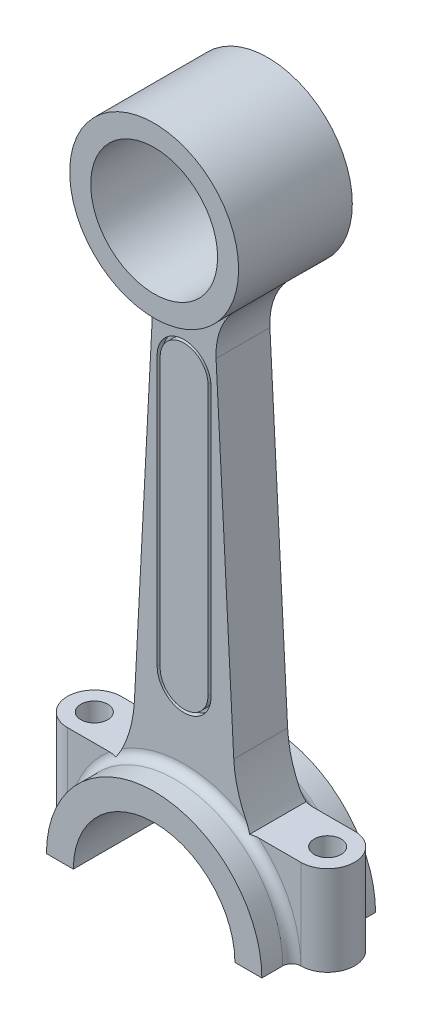
from build123d import *

# Parameters (mm, degrees)
SKETCH1_R               = 28.232840849
SKETCH1_R_2             = 21.20600046
BOSS_EXTRUDE1_DEPTH     = 19
BOSS_EXTRUDE1_2_DEPTH   = 19
BOSS_EXTRUDE2_DEPTH     = 9
FILLET1_R               = 22.5
FILLET2_R               = 40
CUT_EXTRUDE_THIN1_DEPTH = 2
BOSS_EXTRUDE3_DEPTH     = 30
SKETCH5_R               = 4.5
CUT_EXTRUDE1_DEPTH      = 30
CUT_EXTRUDE2_DEPTH      = 30
FILLET3_R               = 3


with BuildPart() as part:
    # Sketch1 → Boss-Extrude1 (new, symmetric)
    with BuildSketch(Plane.XY):
        with Locations((0, 201.2)):
            Circle(SKETCH1_R)
        with Locations((0, 201.2)):
            Circle(SKETCH1_R_2, mode=Mode.SUBTRACT)
    extrude(amount=BOSS_EXTRUDE1_DEPTH, both=True)



with BuildPart() as body_2:
    # Sketch1 → Boss-Extrude1 2 (new, symmetric)
    with BuildSketch(Plane.XY):
        with BuildLine():
            Line((-36, 0), (-27, 0))
            ThreePointArc((-27, 0), (0, 27), (27, 0))
            Line((27, 0), (36, 0))
            ThreePointArc((36, 0), (0, 36), (-36, 0))
        make_face()
    extrude(amount=BOSS_EXTRUDE1_2_DEPTH, both=True)


with BuildPart() as part_1:
    add(part.part)

    add(body_2.part)  # Boss-Extrude2 merges body 2
    # Sketch2 → Boss-Extrude2 (add, symmetric)
    with BuildSketch(Plane.XY):
        with BuildLine():
            Line((-10, 174.797475454), (-17.512343456, 31.453423132))
            ThreePointArc((-17.512343456, 31.453423132), (0, 36), (17.512343456, 31.453423132))
            Line((17.512343456, 31.453423132), (10, 174.797475454))
            ThreePointArc((10, 174.797475454), (0, 172.967159151), (-10, 174.797475454))
        make_face()
    extrude(amount=BOSS_EXTRUDE2_DEPTH, both=True)

    # Fillet1
    fillet1_edges = [part_1.edges().sort_by_distance(p)[0] for p in [
        (10, 174.797475454, 0),
        (-10, 174.797475454, 0),
    ]]
    fillet(fillet1_edges, radius=FILLET1_R)

    # Fillet2
    fillet2_edges = [part_1.edges().sort_by_distance(p)[0] for p in [
        (-17.512343456, 31.453423132, 0),
        (17.512343456, 31.453423132, 0),
    ]]
    fillet(fillet2_edges, radius=FILLET2_R)

    # Sketch3 → Cut-Extrude-Thin1 (cut, symmetric)
    with BuildSketch(Plane.XY.offset(9)):
        with BuildLine():
            Line((-9, 62.771407141), (-9, 152.771407141))
            ThreePointArc((-9, 152.771407141), (0, 161.771407141), (9, 152.771407141))
            Line((9, 152.771407141), (9, 62.771407141))
            ThreePointArc((9, 62.771407141), (0, 53.771407141), (-9, 62.771407141))
        make_face()
        with BuildLine():
            Line((-8, 62.771407141), (-8, 152.771407141))
            ThreePointArc((-8, 152.771407141), (0, 160.771407141), (8, 152.771407141))
            Line((8, 152.771407141), (8, 62.771407141))
            ThreePointArc((8, 62.771407141), (0, 54.771407141), (-8, 62.771407141))
        make_face(mode=Mode.SUBTRACT)
    extrude(amount=CUT_EXTRUDE_THIN1_DEPTH, both=True, mode=Mode.SUBTRACT)

    # Sketch4 → Boss-Extrude3 (add)
    with BuildSketch(Plane(origin=(0, 0, 0), x_dir=(1, 0, 0), z_dir=(0, 1, 0))):
        with BuildLine():
            Line((-39, 9), (39, 9))
            ThreePointArc((39, 9), (48, 0), (39, -9))
            Line((39, -9), (-39, -9))
            ThreePointArc((-39, -9), (-48, 0), (-39, 9))
        make_face()
    extrude(amount=BOSS_EXTRUDE3_DEPTH)

    # Sketch5 → Cut-Extrude1 (cut)
    with BuildSketch(Plane(origin=(0, 30, 0), x_dir=(1, 0, 0), z_dir=(0, 1, 0))):
        with Locations(Location((-39, 0, 0), (0, 0, 270))):
            Circle(SKETCH5_R)
        with Locations(Location((39, 0, 0), (0, 0, 270))):
            Circle(SKETCH5_R)
    extrude(amount=-CUT_EXTRUDE1_DEPTH, mode=Mode.SUBTRACT)

    # Sketch7 → Cut-Extrude2 (cut)
    with BuildSketch(Plane.XY.offset(9)):
        with BuildLine():
            Line((-27, 0), (27, 0))
            ThreePointArc((27, 0), (0, 27), (-27, 0))
        make_face()
    extrude(amount=-CUT_EXTRUDE2_DEPTH, mode=Mode.SUBTRACT)

    # Fillet3
    # the kernel refuses this fillet: 3 mm, written as the material it adds along each edge
    with BuildSketch(Plane(origin=(0, 0, -9), x_dir=(1, 0, 0), z_dir=(0, -1, 0))) as fillet3_piece_1_section:
        with BuildLine():
            CenterArc((36 + FILLET3_R, -FILLET3_R), FILLET3_R, 90, 90)
            Line((36 + FILLET3_R, 0), (36, 0))
            Line((36, 0), (36, -FILLET3_R))
        make_face()
    fillet3_piece_1 = revolve(axis=Axis((0, 0, -9), (0, 0, 1)), revolution_arc=180, mode=Mode.PRIVATE)
    fillet3_piece_1 = split(fillet3_piece_1, bisect_by=Plane(origin=(34.368782616, 30, -9.69889031), z_dir=(0, -1, 0)), keep=Keep.TOP, mode=Mode.PRIVATE)
    add(fillet3_piece_1)
    with BuildSketch(Plane(origin=(0, 0, -9), x_dir=(1, 0, 0), z_dir=(0, -1, 0))) as fillet3_piece_2_section:
        with BuildLine():
            CenterArc((36 + FILLET3_R, -FILLET3_R), FILLET3_R, 90, 90)
            Line((36 + FILLET3_R, 0), (36, 0))
            Line((36, 0), (36, -FILLET3_R))
        make_face()
    fillet3_piece_2 = revolve(axis=Axis((0, 0, -9), (0, 0, 1)), revolution_arc=180, mode=Mode.PRIVATE)
    fillet3_piece_2 = fillet3_piece_2 - Plane(origin=(-56.554925494, 50.769482983, -9.84745497), x_dir=(0.9986295347545739, -0.05233595624294397, 0), z_dir=(0, 0, -1)) * Cylinder(40, 156, mode=Mode.PRIVATE)
    fillet3_piece_2 = fillet3_piece_2 - Plane(origin=(56.554925494, 50.769482983, -9.84745497), x_dir=(-0.9986295347545739, -0.05233595624294397, 0), z_dir=(0, 0, -1)) * Cylinder(40, 156, mode=Mode.PRIVATE)
    add(fillet3_piece_2)
    with BuildSketch(Plane(origin=(0, 0, 9), x_dir=(-1, 0, 0), z_dir=(0, -1, 0))) as fillet3_piece_3_section:
        with BuildLine():
            CenterArc((36 + FILLET3_R, -FILLET3_R), FILLET3_R, 90, 90)
            Line((36, -FILLET3_R), (36, 0))
            Line((36, 0), (36 + FILLET3_R, 0))
        make_face()
    fillet3_piece_3 = revolve(axis=Axis((0, 0, 9), (0, 0, -1)), revolution_arc=180, mode=Mode.PRIVATE)
    fillet3_piece_3 = split(fillet3_piece_3, bisect_by=Plane(origin=(-34.368785519, 30, 9.698889588), z_dir=(0, -1, 0)), keep=Keep.TOP, mode=Mode.PRIVATE)
    add(fillet3_piece_3)
    with BuildSketch(Plane(origin=(0, 0, 9), x_dir=(-1, 0, 0), z_dir=(0, -1, 0))) as fillet3_piece_4_section:
        with BuildLine():
            CenterArc((36 + FILLET3_R, -FILLET3_R), FILLET3_R, 90, 90)
            Line((36, -FILLET3_R), (36, 0))
            Line((36, 0), (36 + FILLET3_R, 0))
        make_face()
    fillet3_piece_4 = revolve(axis=Axis((0, 0, 9), (0, 0, -1)), revolution_arc=180, mode=Mode.PRIVATE)
    fillet3_piece_4 = fillet3_piece_4 - Plane(origin=(-56.554925494, 50.769482983, 10.5000003), x_dir=(0.9986295347545739, -0.05233595624294397, 0), z_dir=(0, 0, -1)) * Cylinder(40, 156, mode=Mode.PRIVATE)
    fillet3_piece_4 = fillet3_piece_4 - Plane(origin=(56.554925494, 50.769482983, 10.5000003), x_dir=(-0.9986295347545739, -0.05233595624294397, 0), z_dir=(0, 0, -1)) * Cylinder(40, 156, mode=Mode.PRIVATE)
    add(fillet3_piece_4)


solid = part_1.part
